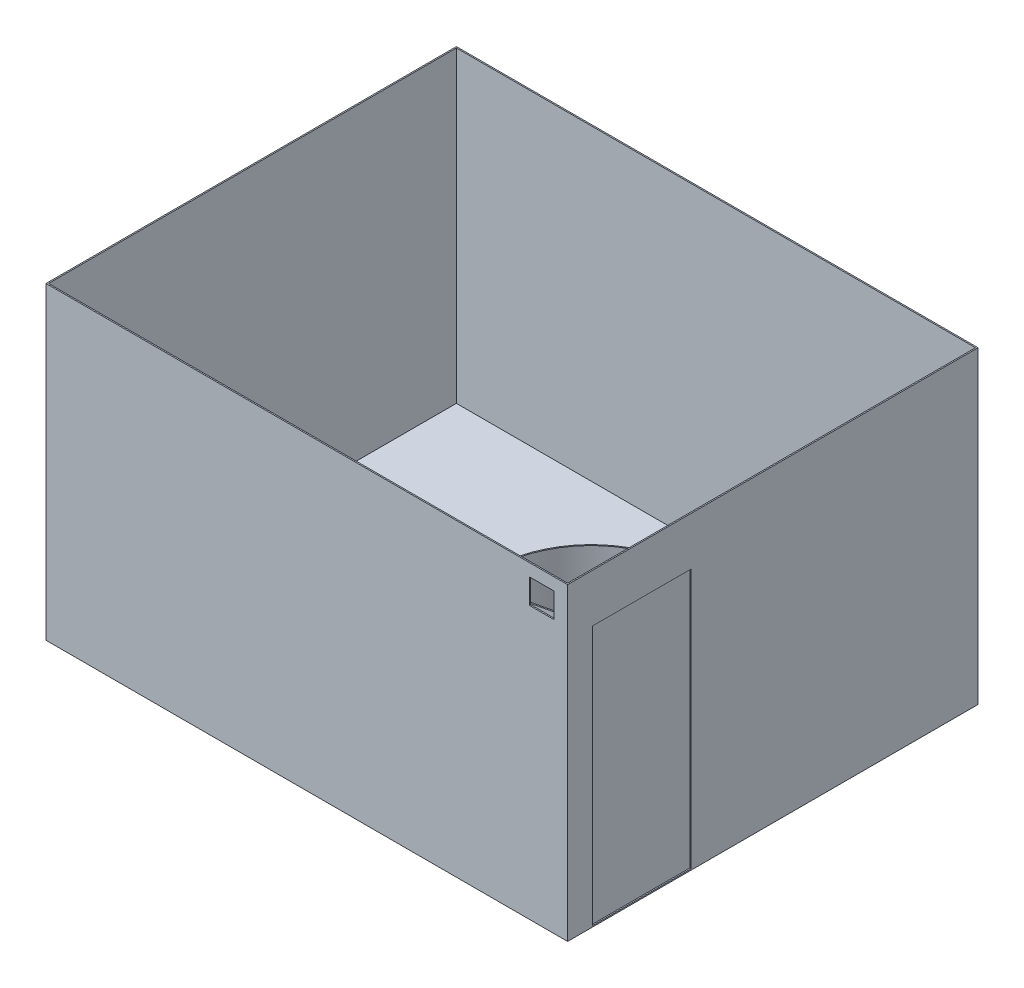
from build123d import *

# Parameters (mm, degrees)
CROQUIS1_W              = 4220
CROQUIS1_H              = 3320
CROQUIS1_W_2            = 4200
CROQUIS1_H_2            = 3300
SALIENTE_EXTRUIR1_DEPTH = 2500
CROQUIS2_W              = 4220
CROQUIS2_H              = 3320
SALIENTE_EXTRUIR2_DEPTH = 10
CROQUIS4_W              = 800
CROQUIS4_H              = 2100
CORTAR_EXTRUIR1_DEPTH   = 5171.07736886
CROQUIS5_W              = 200
CROQUIS5_H              = 200
CORTAR_EXTRUIR2_DEPTH   = 4654.837126501
BARRER1_START           = 10
BARRER1_DEPTH           = 2100


# Read off the part's stored shape, not the designer's step: Barrer1
with BuildPart() as part:
    # Croquis1 → Saliente-Extruir1 (new body)
    with BuildSketch(Plane(origin=(0, 0, 0), x_dir=(1, 0, 0), z_dir=(0, 1, 0))):
        Rectangle(CROQUIS1_W, CROQUIS1_H)
        Rectangle(CROQUIS1_W_2, CROQUIS1_H_2, mode=Mode.SUBTRACT)
    extrude(amount=SALIENTE_EXTRUIR1_DEPTH)

    # Croquis2 → Saliente-Extruir2 (add)
    with BuildSketch(Plane(origin=(0, 0, 0), x_dir=(1, 0, 0), z_dir=(0, 1, 0))):
        Rectangle(CROQUIS2_W, CROQUIS2_H)
    extrude(amount=SALIENTE_EXTRUIR2_DEPTH)

    # Croquis4 → Cortar-Extruir1 (cut, through all)
    with BuildSketch(Plane.ZY.offset(-2100)):
        with Locations((1060, 1060)):
            Rectangle(CROQUIS4_W, CROQUIS4_H)
    extrude(amount=-CORTAR_EXTRUIR1_DEPTH, mode=Mode.SUBTRACT)

    # Croquis5 → Cortar-Extruir2 (cut, through all)
    with BuildSketch(Plane(origin=(0, 0, 1650), x_dir=(-1, 0, 0), z_dir=(0, 0, -1))):
        with Locations((-1900, 2300)):
            Rectangle(CROQUIS5_W, CROQUIS5_H)
    extrude(amount=-CORTAR_EXTRUIR2_DEPTH, mode=Mode.SUBTRACT)


with BuildPart() as body_2:
    # Barrer1 outline → Barrer1 (new body)
    with BuildSketch(Plane(origin=(0, 0, 0), x_dir=(1, 0, 0), z_dir=(0, 1, 0)).offset(BARRER1_START)):
        with BuildLine():
            Line((2100, -1460), (2100, -660))
            add(Edge.make_bspline(
                [(2100, -660), (2073.912540262, -660), (2047.205425142, -661.277427646), (1998.537748561, -666.165802924), (1971.022170868, -670.043272858), (1943.228244208, -675.488942545), (1909.594641716, -682.46904502), (1881.519722969, -689.847207107), (1837.098749393, -704.235952802), (1809.074027841, -714.316425373), (1781.256702654, -726.131802199), (1742.063038297, -743.896197944), (1714.717308152, -758.197430259), (1677.988959354, -780.261991885), (1651.543173099, -796.949389048), (1625.872718869, -815.333799698), (1585.17176187, -846.847049938), (1561.086008122, -867.886566729), (1534.439687048, -894.163886437), (1511.840013415, -916.906423496), (1490.555696644, -941.065070966), (1454.68396975, -986.164337367), (1436.128749015, -1012.493555913), (1419.272719168, -1039.747680905), (1401.813439136, -1068.129951729), (1386.732696165, -1096.332008248), (1363.911456334, -1145.843241347), (1351.948297409, -1175.047830985), (1341.81546422, -1204.593997119), (1329.503910263, -1242.502010967), (1321.722168511, -1272.364340048), (1312.848105033, -1316.456716804), (1307.708813562, -1346.214672379), (1304.29926654, -1375.766346194), (1300.436814682, -1420.406205825), (1299.564694512, -1449.42133541), (1300.351434012, -1484.672768197), (1301.347205401, -1512.960524023), (1303.802172385, -1540.618483017), (1309.878882682, -1588.271722102), (1314.643310763, -1614.581454987), (1320.512989204, -1640)],
                knots=[0, 0, 0, 0, 0.0625, 0.0625, 0.112, 0.125, 0.125, 0.1875, 0.1875, 0.224, 0.25, 0.25, 0.3125, 0.3125, 0.336, 0.375, 0.375, 0.4375, 0.4375, 0.448, 0.5, 0.5, 0.56, 0.5625, 0.5625, 0.625, 0.625, 0.67, 0.6875, 0.6875, 0.75, 0.75, 0.78, 0.8125, 0.8125, 0.875, 0.875, 0.89, 0.9375, 0.9375, 1, 1, 1, 1], degree=3))
            Line((1320.512989204, -1640), (2100, -1460))
        make_face()
        with BuildLine():
            add(Edge.make_bspline(
                [(2090, -670), (2064.849260042, -670.253192381), (2039.078864701, -671.783812407), (1992.056644326, -677.046092349), (1965.444640774, -681.096938582), (1938.521142618, -686.636168487), (1905.931004824, -693.710028058), (1878.687990861, -701.089136682), (1835.543798301, -715.38192305), (1808.310025372, -725.365883516), (1781.261316695, -737.032063098), (1743.141179806, -754.55386536), (1716.52840869, -768.630587485), (1680.764535289, -790.311377267), (1655.007631837, -806.699418418), (1629.991452554, -824.729625587), (1590.314129043, -855.615970934), (1566.820296032, -876.218466231), (1540.813402898, -901.932989718), (1518.75371452, -924.186150168), (1497.963897958, -947.811633291), (1462.905445265, -991.895874509), (1444.757140396, -1017.620300495), (1428.255239518, -1044.234065636), (1411.162048773, -1071.948896661), (1396.380313755, -1099.473954468), (1373.973000452, -1147.77467233), (1362.20848233, -1176.256185803), (1352.212083497, -1205.058563682), (1340.053182448, -1242.007707676), (1332.329364093, -1271.10188819), (1323.454846244, -1314.038121597), (1318.28729717, -1343.008645137), (1314.792753157, -1371.762738566), (1310.749302629, -1415.180945405), (1309.692563847, -1443.380551133), (1310.148118635, -1477.602145971), (1310.857013779, -1505.055789573), (1312.938576617, -1531.863881157), (1318.292334413, -1578.009379659), (1322.596830446, -1603.453489949), (1328.006576839, -1628.006412365)],
                knots=[0, 0, 0, 0, 0.0625, 0.0625, 0.112, 0.125, 0.125, 0.1875, 0.1875, 0.224, 0.25, 0.25, 0.3125, 0.3125, 0.336, 0.375, 0.375, 0.4375, 0.4375, 0.448, 0.5, 0.5, 0.56, 0.5625, 0.5625, 0.625, 0.625, 0.67, 0.6875, 0.6875, 0.75, 0.75, 0.78, 0.8125, 0.8125, 0.875, 0.875, 0.89, 0.9375, 0.9375, 1, 1, 1, 1], degree=3))
            Line((2090, -670), (2090, -1452.04605091))
            Line((2090, -1452.04605091), (1328.006576839, -1628.006412365))
        make_face(mode=Mode.SUBTRACT)
    extrude(amount=BARRER1_DEPTH)


solid = Compound([part.part, body_2.part])
